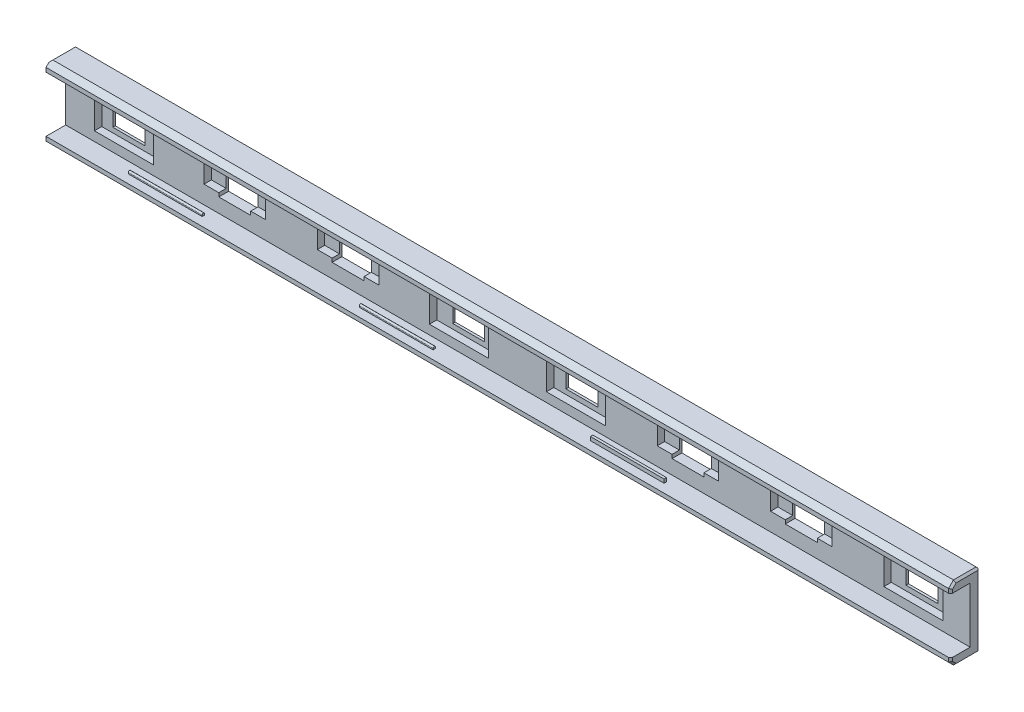
from build123d import *

# Parameters (mm, degrees)
SKETCH1_W               = 184
SKETCH1_H               = 15
BOSS_EXTRUDE1_DEPTH     = 6
CUT_EXTRUDE1_DEPTH      = 141.246944523
CUT_EXTRUDE1_DEPTH_BACK = 141.246944523
SKETCH2_W               = 6.5
SKETCH2_H               = 5.5
CUT_EXTRUDE2_DEPTH      = 141.246944523
CUT_EXTRUDE2_DEPTH_BACK = 141.246944523
SKETCH3_W               = 6.5
SKETCH3_H               = 5.5
CUT_EXTRUDE3_DEPTH      = 141.246944523
CUT_EXTRUDE3_DEPTH_BACK = 141.246944523
SKETCH4_W               = 6.5
SKETCH4_H               = 5.5
CUT_EXTRUDE4_DEPTH      = 141.246944523
CUT_EXTRUDE4_DEPTH_BACK = 141.246944523
SKETCH5_W               = 6.5
SKETCH5_H               = 5.5
CUT_EXTRUDE5_DEPTH      = 141.246944523
CUT_EXTRUDE5_DEPTH_BACK = 4
SKETCH8_W               = 184
SKETCH8_H               = 11.3
SKETCH9_W               = 12
SKETCH9_H               = 7.5
SKETCH9_W_2             = 12.5
SKETCH9_H_2             = 4
CUT_EXTRUDE6_DEPTH      = 1.5
SKETCH10_W              = 12.5
SKETCH10_H              = 4
CUT_EXTRUDE7_DEPTH      = 1.5
CUT_EXTRUDE8_DEPTH      = 184
SKETCH13_W              = 0.5
SKETCH13_H              = 10
CUT_EXTRUDE9_DEPTH      = 0.6
FILLET1_R               = 0.25
FILLET2_R               = 0.25
SKETCH16_W              = 15
SKETCH16_H              = 0.5
BOSS_EXTRUDE2_DEPTH     = 0.75
FILLET3_R               = 0.5
FILLET4_R               = 0.25
SKETCH17_W              = 15
SKETCH17_H              = 0.5
BOSS_EXTRUDE3_DEPTH     = 0.75
FILLET5_R               = 0.5
FILLET6_R               = 0.25
LPATTERN1_COUNT         = 3
LPATTERN1_PITCH         = 47
LPATTERN2_COUNT         = 3
LPATTERN2_PITCH         = 47
FILLET7_R               = 0.5
FILLET8_R               = 0.25
FILLET9_R               = 0.5
FILLET10_R              = 0.25
CHAMFER1_SIZE           = 0.4
CHAMFER2_SIZE           = 0.4
CHAMFER3_SIZE           = 0.4
CHAMFER5_SIZE           = 0.4


# Some blends are built 0.0001 mm under size
with BuildPart() as part:
    # Sketch1 → Boss-Extrude1 (new body)
    with BuildSketch(Plane.XY):
        with Locations((-45.75, 18.154296875)):
            Rectangle(SKETCH1_W, SKETCH1_H)
    extrude(amount=BOSS_EXTRUDE1_DEPTH)

    # Sketch2 → Cut-Extrude1 (cut, two sides: drawn at the far end of the back side and taken through both)
    with BuildSketch(Plane.XY.offset(6).offset(-CUT_EXTRUDE1_DEPTH_BACK)):
        with Locations((-126.4, 18.154296875)):
            Rectangle(SKETCH2_W, SKETCH2_H)
    extrude(amount=CUT_EXTRUDE1_DEPTH + CUT_EXTRUDE1_DEPTH_BACK, mode=Mode.SUBTRACT)

    # Sketch3 → Cut-Extrude2 (cut, two sides: drawn at the far end of the back side and taken through both)
    with BuildSketch(Plane.XY.offset(6).offset(-CUT_EXTRUDE2_DEPTH_BACK)):
        with Locations((-103.35, 18.154296875)):
            Rectangle(SKETCH3_W, SKETCH3_H)
    extrude(amount=CUT_EXTRUDE2_DEPTH + CUT_EXTRUDE2_DEPTH_BACK, mode=Mode.SUBTRACT)

    # Sketch4 → Cut-Extrude3 (cut, two sides: drawn at the far end of the back side and taken through both)
    with BuildSketch(Plane.XY.offset(6).offset(-CUT_EXTRUDE3_DEPTH_BACK)):
        with Locations((-80.3, 18.154296875)):
            Rectangle(SKETCH4_W, SKETCH4_H)
    extrude(amount=CUT_EXTRUDE3_DEPTH + CUT_EXTRUDE3_DEPTH_BACK, mode=Mode.SUBTRACT)

    # Sketch5 → Cut-Extrude4 (cut, two sides: drawn at the far end of the back side and taken through both)
    with BuildSketch(Plane.XY.offset(6).offset(-CUT_EXTRUDE4_DEPTH_BACK)):
        with Locations((-57.25, 18.154296875)):
            Rectangle(SKETCH5_W, SKETCH5_H)
        with Locations((-34.2, 18.154296875)):
            Rectangle(SKETCH5_W, SKETCH5_H)
        with Locations((-11.15, 18.154296875)):
            Rectangle(SKETCH5_W, SKETCH5_H)
        with Locations((11.9, 18.154296875)):
            Rectangle(SKETCH5_W, SKETCH5_H)
        with Locations((34.95, 18.154296875)):
            Rectangle(SKETCH5_W, SKETCH5_H)
    extrude(amount=CUT_EXTRUDE4_DEPTH + CUT_EXTRUDE4_DEPTH_BACK, mode=Mode.SUBTRACT)

    # Sketch8 → Cut-Extrude5 (cut, two sides: drawn at the far end of the back side and taken through both)
    with BuildSketch(Plane.XY.offset(6).offset(-CUT_EXTRUDE5_DEPTH_BACK)):
        with Locations((-45.75, 18.154296875)):
            Rectangle(SKETCH8_W, SKETCH8_H)
    extrude(amount=CUT_EXTRUDE5_DEPTH + CUT_EXTRUDE5_DEPTH_BACK, mode=Mode.SUBTRACT)

    # Sketch9 → Cut-Extrude6 (cut)
    with BuildSketch(Plane.XY.offset(2)):
        with Locations((-57.75, 18.154296875)):
            Rectangle(SKETCH9_W, SKETCH9_H)
        with Locations((-33.95, 18.154296875)):
            Rectangle(SKETCH9_W, SKETCH9_H)
        with Locations((-125.9, 18.154296875)):
            Rectangle(SKETCH9_W, SKETCH9_H)
        with Locations((-11.15, 18.154296875)):
            Rectangle(SKETCH9_W_2, SKETCH9_H_2)
        with Locations((11.9, 18.154296875)):
            Rectangle(SKETCH9_W_2, SKETCH9_H_2)
        with Locations((34.7, 18.154296875)):
            Rectangle(SKETCH9_W, SKETCH9_H)
    extrude(amount=-CUT_EXTRUDE6_DEPTH, mode=Mode.SUBTRACT)

    # Sketch10 → Cut-Extrude7 (cut)
    with BuildSketch(Plane.XY.offset(2)):
        with Locations((-80.3, 18.154296875)):
            Rectangle(SKETCH10_W, SKETCH10_H)
        with Locations((-103.35, 18.154296875)):
            Rectangle(SKETCH10_W, SKETCH10_H)
    extrude(amount=-CUT_EXTRUDE7_DEPTH, mode=Mode.SUBTRACT)

    # Sketch12 → Cut-Extrude8 (cut)
    with BuildSketch(Plane(origin=(46.25, 0, 0), x_dir=(0, 0, -1), z_dir=(1, 0, 0))):
        Polygon((-6, 25.654296875), (-6, 24.654296875), (-5, 25.654296875), align=None)
        Polygon((-6, 10.654296875), (-5, 10.654296875), (-6, 11.654296875), align=None)
    extrude(amount=-CUT_EXTRUDE8_DEPTH, mode=Mode.SUBTRACT)

    # Sketch13 → Cut-Extrude9 (cut)
    with BuildSketch(Plane(origin=(0, 0, 0), x_dir=(-1, 0, 0), z_dir=(0, 0, -1))):
        with Locations((135.5, 18.154296875)):
            Rectangle(SKETCH13_W, SKETCH13_H)
    extrude(amount=-CUT_EXTRUDE9_DEPTH, mode=Mode.SUBTRACT)

    # Fillet1
    fillet1_edges = [part.edges().sort_by_distance(p)[0] for p in [
        (-135.75, 18.154296875, 0),
    ]]
    fillet(fillet1_edges, radius=FILLET1_R)

    # Fillet2
    fillet2_edges = [part.edges().sort_by_distance(p)[0] for p in [
        (-135.25, 18.154296875, 0.6),
        (-135.5, 23.154296875, 0.6),
        (-135.75, 18.154296875, 0.6),
        (-135.5, 13.154296875, 0.6),
    ]]
    fillet(fillet2_edges, radius=FILLET2_R - 0.0001)  # a hair under: the kernel refuses the full size

    # Sketch16 → Boss-Extrude2 (add)
    with BuildSketch(Plane.XZ.offset(-23.804296875)):
        with Locations((-115.25, 4)):
            Rectangle(SKETCH16_W, SKETCH16_H)
    boss_extrude2 = extrude(amount=BOSS_EXTRUDE2_DEPTH)

    # Fillet3
    fillet3_edges = [part.edges().sort_by_distance(p)[0] for p in [
        (-115.25, 23.054296875, 4.25),
    ]]
    fillet(fillet3_edges, radius=FILLET3_R - 0.0001)  # a hair under: the kernel refuses the full size

    # Fillet4
    # the kernel refuses this fillet: 0.25 mm, written as the material it takes off along each edge
    with BuildSketch(Plane(origin=(-124.517583763, 23.054296875, 3.75), x_dir=(0, 0.7070334884245003, 0.7071800663524687), z_dir=(1, 0, 0))) as fillet4_piece_1:
        with BuildLine():
            CenterArc((0.530239772, -0.176759658), FILLET4_R, 44.994478191, 179.999583317)
            Line((0.353444756, -0.35351803), (0.335765254, -0.371193867))
            Line((0.335765254, -0.371193867), (-0.017679502, -0.017675837))
            Line((-0.017679502, -0.017675837), (-0.017675837, 0.017679502))
            ThreePointArc((-0.017675837, 0.017679502), (-0.017605119, 0.017750205), (0.724712877, 0.017675966))
            Line((0.724712877, 0.017675966), (0.707033504, 0))
        make_face()
    extrude(amount=18.535167526, mode=Mode.SUBTRACT)

    # Sketch17 → Boss-Extrude3 (add)
    with BuildSketch(Plane(origin=(0, 12.504296875, 0), x_dir=(1, 0, 0), z_dir=(0, 1, 0))):
        with Locations((-115.25, -4)):
            Rectangle(SKETCH17_W, SKETCH17_H)
    boss_extrude3 = extrude(amount=BOSS_EXTRUDE3_DEPTH)

    # Fillet5
    fillet5_edges = [part.edges().sort_by_distance(p)[0] for p in [
        (-115.25, 13.254296875, 4.25),
    ]]
    fillet(fillet5_edges, radius=FILLET5_R - 0.0001)  # a hair under: the kernel refuses the full size

    # Fillet6
    # the kernel refuses this fillet: 0.25 mm, written as the material it takes off along each edge
    with BuildSketch(Plane(origin=(-105.982416233, 13.254296875, 3.75), x_dir=(0, -0.7070334900459336, 0.7071800647313715), z_dir=(-1, 0, 0))) as fillet6_piece_1:
        with BuildLine():
            CenterArc((0.530239774, -0.176759657), FILLET6_R, 44.994478059, 179.99958358)
            Line((0.353444758, -0.35351803), (0.335765256, -0.371193867))
            Line((0.335765256, -0.371193867), (-0.017679502, -0.017675837))
            Line((-0.017679502, -0.017675837), (-0.017675837, 0.017679502))
            ThreePointArc((-0.017675837, 0.017679502), (-0.017605119, 0.017750205), (0.724712878, 0.017675966))
            Line((0.724712878, 0.017675966), (0.707033505, 0))
        make_face()
    extrude(amount=18.535167534, mode=Mode.SUBTRACT)

    # LPattern1: Boss-Extrude3 ×3
    with Locations(*[(i * LPATTERN1_PITCH, 0, 0) for i in range(1, LPATTERN1_COUNT)]):
        add(boss_extrude3)

    # LPattern2: Boss-Extrude2 ×3
    with Locations(*[(i * LPATTERN2_PITCH, 0, 0) for i in range(1, LPATTERN2_COUNT)]):
        add(boss_extrude2)

    # Fillet7
    fillet7_edges = [part.edges().sort_by_distance(p)[0] for p in [
        (-68.25, 23.054296875, 4.25),
    ]]
    fillet(fillet7_edges, radius=FILLET7_R - 0.0001)  # a hair under: the kernel refuses the full size

    # Fillet8
    # the kernel refuses this fillet: 0.25 mm, written as the material it takes off along each edge
    with BuildSketch(Plane(origin=(-77.517583763, 23.054296875, 3.75), x_dir=(0, 0.7070334884245003, 0.7071800663524687), z_dir=(1, 0, 0))) as fillet8_piece_1:
        with BuildLine():
            CenterArc((0.530239772, -0.176759658), FILLET8_R, 44.994478191, 179.999583317)
            Line((0.353444756, -0.35351803), (0.335765254, -0.371193867))
            Line((0.335765254, -0.371193867), (-0.017679502, -0.017675837))
            Line((-0.017679502, -0.017675837), (-0.017675837, 0.017679502))
            ThreePointArc((-0.017675837, 0.017679502), (-0.017605119, 0.017750205), (0.724712877, 0.017675966))
            Line((0.724712877, 0.017675966), (0.707033504, 0))
        make_face()
    extrude(amount=18.535167526, mode=Mode.SUBTRACT)

    # Fillet9
    fillet9_edges = [part.edges().sort_by_distance(p)[0] for p in [
        (-68.25, 13.254296875, 4.25),
    ]]
    fillet(fillet9_edges, radius=FILLET9_R - 0.0001)  # a hair under: the kernel refuses the full size

    # Fillet10
    # the kernel refuses this fillet: 0.25 mm, written as the material it takes off along each edge
    with BuildSketch(Plane(origin=(-58.982416233, 13.254296875, 3.75), x_dir=(0, -0.7070334916347167, 0.7071800631429177), z_dir=(-1, 0, 0))) as fillet10_piece_1:
        with BuildLine():
            CenterArc((0.530239775, -0.176759657), FILLET10_R, 44.994477931, 179.999583837)
            Line((0.353444759, -0.35351803), (0.335765258, -0.371193867))
            Line((0.335765258, -0.371193867), (-0.017679502, -0.017675837))
            Line((-0.017679502, -0.017675837), (-0.017675837, 0.017679502))
            ThreePointArc((-0.017675837, 0.017679502), (-0.017605119, 0.017750205), (0.72471288, 0.017675966))
            Line((0.72471288, 0.017675966), (0.707033507, 0))
        make_face()
    extrude(amount=18.535167534, mode=Mode.SUBTRACT)

    # Chamfer1
    chamfer1_edges = [part.edges().sort_by_distance(p)[0] for p in [
        (-45.75, 25.654296875, 0),
        (-45.75, 10.654296875, 0),
    ]]
    chamfer(chamfer1_edges, length=CHAMFER1_SIZE)

    # Chamfer2
    chamfer2_edges = [part.edges().sort_by_distance(p)[0] for p in [
        (46.25, 18.154296875, 0),
        (-137.75, 18.154296875, 0),
    ]]
    chamfer(chamfer2_edges, length=CHAMFER2_SIZE)

    # Chamfer3
    chamfer3_edges = [part.edges().sort_by_distance(p)[0] for p in [
        (-137.75, 25.654296875, 2.7),
        (-137.75, 10.654296875, 2.7),
    ]]
    chamfer(chamfer3_edges, length=CHAMFER3_SIZE)

    # Chamfer5
    chamfer5_edges = [part.edges().sort_by_distance(p)[0] for p in [
        (46.25, 24.229296875, 6),
        (46.25, 25.654296875, 2.7),
        (46.25, 10.654296875, 2.7),
        (46.25, 12.079296875, 6),
        (46.25, 25.154296875, 5.5),
        (46.25, 11.154296875, 5.5),
    ]]
    chamfer(chamfer5_edges, length=CHAMFER5_SIZE)


solid = part.part
